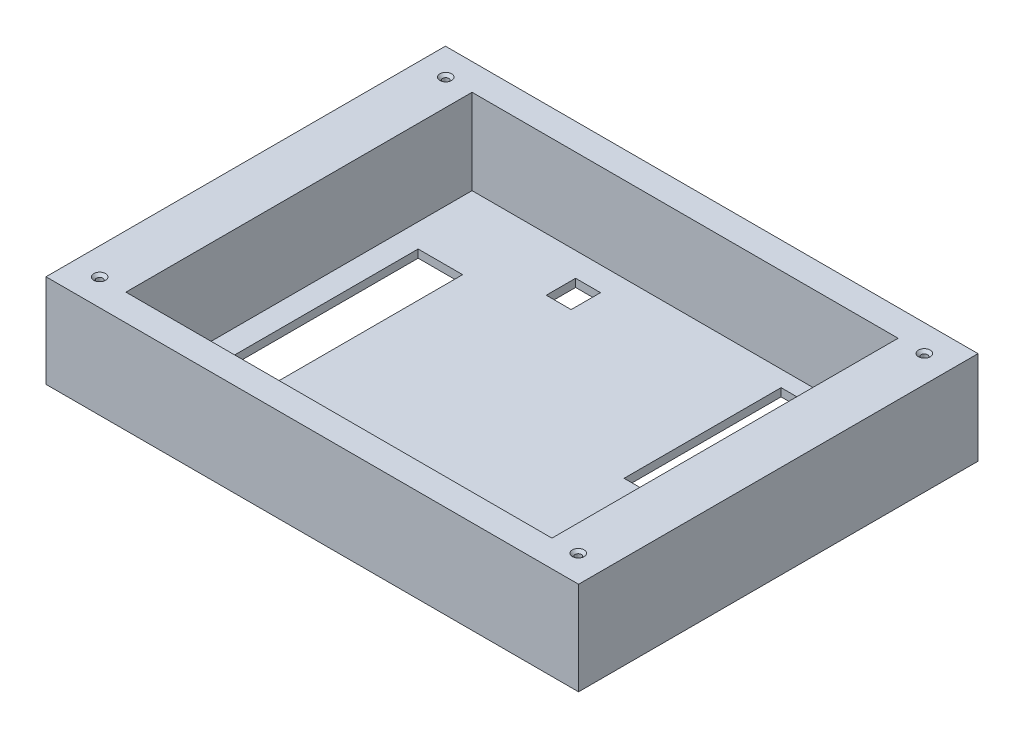
from build123d import *

# Parameters (mm, degrees)
SKETCH6_W                                       = 200
SKETCH6_H                                       = 150
BOSS_EXTRUDE1_DEPTH                             = 35
SKETCH7_W                                       = 160
SKETCH7_H                                       = 130
CUT_EXTRUDE1_DEPTH                              = 32
SKETCH8_W                                       = 16.702633003
SKETCH8_H                                       = 80.840743735
SKETCH8_W_2                                     = 9.353474482
SKETCH8_H_2                                     = 11.023737782
SKETCH8_W_3                                     = 14.698317042
SKETCH8_H_3                                     = 58.960294501
SKETCH8_W_4                                     = 13.362106403
SKETCH8_H_4                                     = 13.362106403
CUT_EXTRUDE2_DEPTH                              = 32
CSK_FOR_M2_FLAT_HEAD_MACHINE_SCREW2_D           = 2.4
CSK_FOR_M2_FLAT_HEAD_MACHINE_SCREW2_DEPTH       = 9.278967257
CSK_FOR_M2_FLAT_HEAD_MACHINE_SCREW2_CSINK_D     = 4.4
CSK_FOR_M2_FLAT_HEAD_MACHINE_SCREW2_CSINK_ANGLE = 90
CSK_FOR_M2_FLAT_HEAD_MACHINE_SCREW2_TIP         = 0.721032743


with BuildPart() as part:
    # Sketch6 → Boss-Extrude1 (new body)
    with BuildSketch(Plane(origin=(0, 0, 0), x_dir=(1, 0, 0), z_dir=(0, 1, 0))):
        Rectangle(SKETCH6_W, SKETCH6_H)
    extrude(amount=BOSS_EXTRUDE1_DEPTH)

    # Sketch7 → Cut-Extrude1 (cut)
    with BuildSketch(Plane(origin=(0, 35, 0), x_dir=(1, 0, 0), z_dir=(0, 1, 0))):
        Rectangle(SKETCH7_W, SKETCH7_H)
    extrude(amount=-CUT_EXTRUDE1_DEPTH, mode=Mode.SUBTRACT)

    # Sketch8 → Cut-Extrude2 (cut)
    with BuildSketch(Plane.XZ):
        with Locations((-62.801900092, 4.509710911)):
            Rectangle(SKETCH8_W, SKETCH8_H)
        with Locations((-27.392318125, -50.441951669)):
            Rectangle(SKETCH8_W_2, SKETCH8_H_2)
        with Locations((49.439793689, -29.480147251)):
            Rectangle(SKETCH8_W_3, SKETCH8_H_3)
        with Locations((78.168322455, -14.197238053)):
            Rectangle(SKETCH8_W_4, SKETCH8_H_4)
    extrude(amount=-CUT_EXTRUDE2_DEPTH, mode=Mode.SUBTRACT)

    # CSK for M2 Flat Head Machine Screw2
    with Locations(Plane(origin=(0, 35, 0), x_dir=(1, 0, 0), z_dir=(0, 1, 0))):
        with Locations((-89.860165556, -64.973242382), (-89.860165556, 64.973242382), (89.860165556, 65), (89.860165556, -64.973242382)):
            CounterSinkHole(CSK_FOR_M2_FLAT_HEAD_MACHINE_SCREW2_D / 2, CSK_FOR_M2_FLAT_HEAD_MACHINE_SCREW2_CSINK_D / 2, depth=CSK_FOR_M2_FLAT_HEAD_MACHINE_SCREW2_DEPTH, counter_sink_angle=CSK_FOR_M2_FLAT_HEAD_MACHINE_SCREW2_CSINK_ANGLE)
            with Locations((0, 0, -(CSK_FOR_M2_FLAT_HEAD_MACHINE_SCREW2_DEPTH + CSK_FOR_M2_FLAT_HEAD_MACHINE_SCREW2_TIP / 2))):  # 118° drill point
                Cone(0, CSK_FOR_M2_FLAT_HEAD_MACHINE_SCREW2_D / 2, CSK_FOR_M2_FLAT_HEAD_MACHINE_SCREW2_TIP, mode=Mode.SUBTRACT)


solid = part.part
